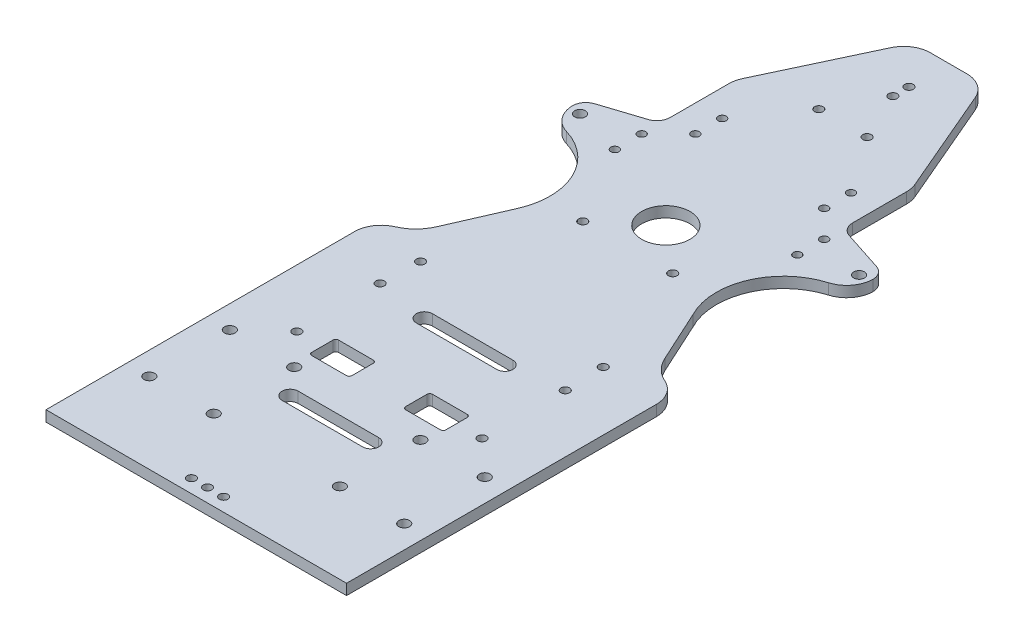
from build123d import *

# Parameters (mm, degrees)
SKETCH1_W               = 112
SKETCH1_H               = 280
SKETCH1_R               = 2
SKETCH1_R_2             = 1.5
BOSS_EXTRUDE1_DEPTH     = 2
CUT_EXTRUDE1_DEPTH      = 203.891596672
CUT_EXTRUDE1_DEPTH_BACK = 203.891596672
CUT_EXTRUDE2_DEPTH      = 203.891596672
CUT_EXTRUDE2_DEPTH_BACK = 203.891596672
SKETCH3_R               = 1.6
SKETCH4_R               = 1.6
CUT_EXTRUDE3_DEPTH      = 203.921166959
CUT_EXTRUDE4_DEPTH      = 203.891596672
CUT_EXTRUDE4_DEPTH_BACK = 203.891596672
SKETCH5_R               = 9
CUT_EXTRUDE5_DEPTH      = 203.891596672
CUT_EXTRUDE5_DEPTH_BACK = 203.891596672
SKETCH6_R               = 1.6
FILLET_1_R              = 5
SKETCH_1_R              = 25
CUT_EXTRUDE_1_DEPTH     = 10
SKETCH_2_R              = 15
SKETCH_2_R_2            = 14.533460532
CUT_EXTRUDE_2_DEPTH     = 10
CUT_EXTRUDE_START       = -5
CUT_EXTRUDE_6_DEPTH     = 6
CUT_EXTRUDE_7_DEPTH     = 6
CUT_EXTRUDE_8_DEPTH     = 5
CUT_EXTRUDE_9_DEPTH     = 5
SKETCH_9_R              = 2
CUT_EXTRUDE_11_DEPTH    = 10
SKETCH_11_R             = 2
CUT_EXTRUDE_12_DEPTH    = 5
SKETCH_12_R             = 2
EXTRUDE_1_DEPTH         = 2
SKETCH_15_R             = 2
CUT_EXTRUDE_13_DEPTH    = 250
FILLET_2_R              = 10
FILLET_3_R              = 10
FILLET_5_R              = 10
FILLET_6_R              = 10
SKETCH_17_R             = 2
CUT_EXTRUDE_16_DEPTH    = 10
CUT_EXTRUDE_17_DEPTH    = 5
CUT_EXTRUDE_18_DEPTH    = 5
FILLET_7_R              = 10
FILLET_8_R              = 10
SKETCH_20_R             = 1.6
EXTRUDE_4_DEPTH         = 7
SKETCH_22_R             = 2
EXTRUDE_6_DEPTH         = 2
SKETCH_23_R             = 1.6
CUT_EXTRUDE_19_DEPTH    = 16.5
SKETCH_24_R             = 1.6
EXTRUDE_7_DEPTH         = 16.5
SKETCH_25_R             = 2
EXTRUDE_8_DEPTH         = 2
SKETCH_26_R             = 1.6
CUT_EXTRUDE_20_DEPTH    = 16.5
SKETCH_27_R             = 1.6
CUT_EXTRUDE_21_DEPTH    = 5
SKETCH_28_R             = 1.6
CUT_EXTRUDE_22_DEPTH    = 5
SKETCH_29_R             = 1.6
CUT_EXTRUDE_23_DEPTH    = 5


with BuildPart() as part:
    # Sketch1 → Boss-Extrude1 (new, symmetric)
    with BuildSketch(Plane(origin=(0, 0, 0), x_dir=(1, 0, 0), z_dir=(0, 1, 0))):
        with Locations((0, -55)):
            Rectangle(SKETCH1_W, SKETCH1_H)
        with Locations(Location((52, 0, 0), (0, 0, 270))):
            Circle(SKETCH1_R, mode=Mode.SUBTRACT)
        with Locations(Location((34, -5, 0), (0, 0, 270))):
            Circle(SKETCH1_R_2, mode=Mode.SUBTRACT)
        with Locations(Location((34, 5, 0), (0, 0, 90))):
            Circle(SKETCH1_R_2, mode=Mode.SUBTRACT)
        with Locations(Location((24, 15, 0), (0, 0, 270))):
            Circle(SKETCH1_R_2, mode=Mode.SUBTRACT)
        with Locations(Location((24, 25, 0), (0, 0, 270))):
            Circle(SKETCH1_R_2, mode=Mode.SUBTRACT)
        with Locations(Location((47.5, -135, 0), (0, 0, 270))):
            Circle(SKETCH1_R, mode=Mode.SUBTRACT)
        with Locations(Location((23.5, -135, 0), (0, 0, 270))):
            Circle(SKETCH1_R, mode=Mode.SUBTRACT)
        with Locations(Location((23.5, -165, 0), (0, 0, 270))):
            Circle(SKETCH1_R, mode=Mode.SUBTRACT)
        with Locations(Location((47.5, -165, 0), (0, 0, 270))):
            Circle(SKETCH1_R, mode=Mode.SUBTRACT)
        with Locations(Location((-47.5, -135, 0), (0, 0, 90))):
            Circle(SKETCH1_R, mode=Mode.SUBTRACT)
        with Locations(Location((-47.5, -165, 0), (0, 0, 90))):
            Circle(SKETCH1_R, mode=Mode.SUBTRACT)
        with Locations(Location((-23.5, -165, 0), (0, 0, 90))):
            Circle(SKETCH1_R, mode=Mode.SUBTRACT)
        with Locations(Location((-23.5, -135, 0), (0, 0, 90))):
            Circle(SKETCH1_R, mode=Mode.SUBTRACT)
        with Locations(Location((-34, -5, 0), (0, 0, 90))):
            Circle(SKETCH1_R_2, mode=Mode.SUBTRACT)
        with Locations(Location((-52, 0, 0), (0, 0, 90))):
            Circle(SKETCH1_R, mode=Mode.SUBTRACT)
        with Locations(Location((-34, 5, 0), (0, 0, 270))):
            Circle(SKETCH1_R_2, mode=Mode.SUBTRACT)
        with Locations(Location((-24, 15, 0), (0, 0, 90))):
            Circle(SKETCH1_R_2, mode=Mode.SUBTRACT)
        with Locations(Location((-24, 25, 0), (0, 0, 90))):
            Circle(SKETCH1_R_2, mode=Mode.SUBTRACT)
    extrude(amount=BOSS_EXTRUDE1_DEPTH, both=True)

    # Sketch2 → Cut-Extrude1 (cut, two sides: drawn at the far end of the back side and taken through both)
    with BuildSketch(Plane(origin=(0, 0, 0), x_dir=(1, 0, 0), z_dir=(0, 1, 0)).offset(-CUT_EXTRUDE1_DEPTH_BACK)):
        Polygon((-56, 4.851766683), (-34, 12), (-34, 85), (-56, 85), align=None)
        Polygon((56, 85), (56, 4.851766683), (34, 12), (34, 85), align=None)
    extrude(amount=CUT_EXTRUDE1_DEPTH + CUT_EXTRUDE1_DEPTH_BACK, mode=Mode.SUBTRACT)

    # Sketch3 → Cut-Extrude2 (cut, two sides: drawn at the far end of the back side and taken through both)
    with BuildSketch(Plane(origin=(0, 0, 0), x_dir=(1, 0, 0), z_dir=(0, 1, 0)).offset(-CUT_EXTRUDE2_DEPTH_BACK)):
        with Locations(Location((-9, 46, 0), (0, 0, 270))):
            Circle(SKETCH3_R)
        with Locations(Location((9, 46, 0), (0, 0, 270))):
            Circle(SKETCH3_R)
    extrude(amount=CUT_EXTRUDE2_DEPTH + CUT_EXTRUDE2_DEPTH_BACK, mode=Mode.SUBTRACT)

    # Sketch4 → Cut-Extrude3 (cut, through all)
    with BuildSketch(Plane(origin=(0, 2, 0), x_dir=(1, 0, 0), z_dir=(0, 1, 0))):
        with Locations(Location((34.04, -77.38, 0), (0, 0, 270))):
            Circle(SKETCH4_R)
        with Locations(Location((-16.76, -34.2, 0), (0, 0, 270))):
            Circle(SKETCH4_R)
    cut_extrude3 = extrude(amount=-CUT_EXTRUDE3_DEPTH, mode=Mode.SUBTRACT)

    # Sketch5 → Cut-Extrude4 (cut, two sides: drawn at the far end of the back side and taken through both)
    with BuildSketch(Plane(origin=(0, 0, 0), x_dir=(1, 0, 0), z_dir=(0, 1, 0)).offset(-CUT_EXTRUDE4_DEPTH_BACK)):
        with Locations(Location((0, -20, 0), (0, 0, 270))):
            Circle(SKETCH5_R)
        with BuildLine():
            Line((-15, -92), (15, -92))
            ThreePointArc((15, -92), (18, -95), (15, -98))
            Line((15, -98), (-15, -98))
            ThreePointArc((-15, -98), (-18, -95), (-15, -92))
        make_face()
        with BuildLine():
            Line((-15, -142), (15, -142))
            ThreePointArc((15, -142), (18, -145), (15, -148))
            Line((15, -148), (-15, -148))
            ThreePointArc((-15, -148), (-18, -145), (-15, -142))
        make_face()
        with BuildLine():
            Line((11, -118), (24, -118))
            ThreePointArc((24, -118), (24.707106781, -118.292893219), (25, -119))
            Line((25, -119), (25, -127))
            ThreePointArc((25, -127), (24.707106781, -127.707106781), (24, -128))
            Line((24, -128), (11, -128))
            ThreePointArc((11, -128), (10.292893219, -127.707106781), (10, -127))
            Line((10, -127), (10, -119))
            ThreePointArc((10, -119), (10.292893219, -118.292893219), (11, -118))
        make_face()
        with BuildLine():
            Line((-25, -119), (-25, -127))
            ThreePointArc((-25, -127), (-24.707106781, -127.707106781), (-24, -128))
            Line((-24, -128), (-11, -128))
            ThreePointArc((-11, -128), (-10.292893219, -127.707106781), (-10, -127))
            Line((-10, -127), (-10, -119))
            ThreePointArc((-10, -119), (-10.292893219, -118.292893219), (-11, -118))
            Line((-11, -118), (-24, -118))
            ThreePointArc((-24, -118), (-24.707106781, -118.292893219), (-25, -119))
        make_face()
    extrude(amount=CUT_EXTRUDE4_DEPTH + CUT_EXTRUDE4_DEPTH_BACK, mode=Mode.SUBTRACT)

    # Sketch6 → Cut-Extrude5 (cut, two sides: drawn at the far end of the back side and taken through both)
    with BuildSketch(Plane(origin=(0, 0, 0), x_dir=(1, 0, 0), z_dir=(0, 1, 0)).offset(-CUT_EXTRUDE5_DEPTH_BACK)):
        with Locations(Location((-34.5, -92, 0), (0, 0, 270))):
            Circle(SKETCH6_R)
        with Locations(Location((34.5, -92, 0), (0, 0, 270))):
            Circle(SKETCH6_R)
        with Locations(Location((34.5, -123, 0), (0, 0, 270))):
            Circle(SKETCH6_R)
        with Locations(Location((-34.5, -123, 0), (0, 0, 270))):
            Circle(SKETCH6_R)
    extrude(amount=CUT_EXTRUDE5_DEPTH + CUT_EXTRUDE5_DEPTH_BACK, mode=Mode.SUBTRACT)

    # Mirror1: Cut-Extrude3 across plane
    add(cut_extrude3.mirror(Plane(origin=(0, 0, 0), x_dir=(0, 0, 1), z_dir=(1, 0, 0))), mode=Mode.SUBTRACT)

    # 圆角1
    fillet_1_edges = [part.edges().sort_by_distance(p)[0] for p in [
        (56, 0, -4.851766683),
        (34, 0, -12),
        (-56, 0, -4.851766683),
        (-34, 0, -12),
    ]]
    fillet(fillet_1_edges, radius=FILLET_1_R)

    # 草图1 → 切除-拉伸1 (cut)
    with BuildSketch(Plane(origin=(0, 2, 0), x_dir=(1, 0, 0), z_dir=(0, 1, 0))):
        with Locations((-56, -32.153325809)):
            Circle(SKETCH_1_R)
        with Locations((56, -32.153325809)):
            Circle(SKETCH_1_R)
    extrude(amount=-CUT_EXTRUDE_1_DEPTH, mode=Mode.SUBTRACT)

    # 草图2 → 切除-拉伸2 (cut)
    with BuildSketch(Plane(origin=(0, 2, 0), x_dir=(1, 0, 0), z_dir=(0, 1, 0))):
        with Locations((-56, -57.153325809)):
            Circle(SKETCH_2_R)
        with Locations((56, -57.153325809)):
            Circle(SKETCH_2_R_2)
    extrude(amount=-CUT_EXTRUDE_2_DEPTH, mode=Mode.SUBTRACT)

    # 切除-拉伸6: read off the stored shape, not the designer's step
    # 切除-拉伸6 outline → 切除-拉伸6 (cut)
    with BuildSketch(Plane(origin=(0, 2, 0), x_dir=(1, 0, 0), z_dir=(0, 1, 0)).offset(CUT_EXTRUDE_START)):
        with BuildLine():
            ThreePointArc((-41.690911979, -52.653325809), (-41.021386735, -57.954040891), (-42.252204443, -63.153168915))
            Line((-42.252204443, -63.153168915), (-33.086952257, -42.152937958))
            ThreePointArc((-33.086952257, -42.152937958), (-36.662565218, -47.998312904), (-41.690911979, -52.653325809))
        make_face()
    extrude(amount=CUT_EXTRUDE_6_DEPTH, mode=Mode.SUBTRACT)

    # 切除-拉伸7: read off the stored shape, not the designer's step
    # 切除-拉伸7 outline → 切除-拉伸7 (cut)
    with BuildSketch(Plane(origin=(0, 2, 0), x_dir=(1, 0, 0), z_dir=(0, 1, 0)).offset(CUT_EXTRUDE_START)):
        with BuildLine():
            Line((33.817769755, -43.683662376), (42.769555279, -63.16804172))
            ThreePointArc((42.769555279, -63.16804172), (41.498065161, -58.110070778), (42.094041909, -52.928896308))
            ThreePointArc((42.094041909, -52.928896308), (37.373193458, -48.827919598), (33.817769755, -43.683662376))
        make_face()
    extrude(amount=CUT_EXTRUDE_7_DEPTH, mode=Mode.SUBTRACT)

    # 草图5 → 切除-拉伸8 (cut, symmetric)
    with BuildSketch(Plane(origin=(0, 0, 0), x_dir=(1, 0, 0), z_dir=(0, 1, 0))):
        Polygon((-34, 71.940987389), (-18.114624984, 85), (-34, 85), align=None)
    extrude(amount=CUT_EXTRUDE_8_DEPTH, both=True, mode=Mode.SUBTRACT)

    # 草图6 → 切除-拉伸9 (cut, symmetric)
    with BuildSketch(Plane(origin=(0, 0, 0), x_dir=(1, 0, 0), z_dir=(0, 1, 0))):
        Polygon((34, 71.940987389), (16.763732813, 85), (34, 85), align=None)
    extrude(amount=CUT_EXTRUDE_9_DEPTH, both=True, mode=Mode.SUBTRACT)

    # 草图9 → 切除-拉伸11 (cut)
    with BuildSketch(Plane(origin=(0, 0, 0), x_dir=(1, 0, 0), z_dir=(0, 1, 0))):
        with Locations(Location((0.81, -190, 0), (0, 0, 270))):
            Circle(SKETCH_9_R)
    extrude(amount=CUT_EXTRUDE_11_DEPTH, mode=Mode.SUBTRACT)

    # 草图11 → 切除-拉伸12 (cut, symmetric)
    with BuildSketch(Plane(origin=(0, 0, 0), x_dir=(1, 0, 0), z_dir=(0, 1, 0))):
        with Locations(Location((0.81, -190, 0), (0, 0, 270))):
            Circle(SKETCH_11_R)
    extrude(amount=CUT_EXTRUDE_12_DEPTH, both=True, mode=Mode.SUBTRACT)

    # 草图12 → 凸台-拉伸1 (add, symmetric)
    with BuildSketch(Plane(origin=(0, 0, 0), x_dir=(1, 0, 0), z_dir=(0, 1, 0))):
        with Locations((0.81, -190)):
            Circle(SKETCH_12_R)
    extrude(amount=EXTRUDE_1_DEPTH, both=True)

    # 草图15 → 切除-拉伸13 (cut, symmetric)
    with BuildSketch(Plane(origin=(0, 0, 0), x_dir=(1, 0, 0), z_dir=(0, 1, 0))):
        with Locations(Location((-0.81, -190, 0), (0, 0, 270))):
            Circle(SKETCH_15_R)
    extrude(amount=CUT_EXTRUDE_13_DEPTH, both=True, mode=Mode.SUBTRACT)

    # 圆角2
    fillet_2_edges = [part.edges().sort_by_distance(p)[0] for p in [
        (-56, 0, 72.153325809),
    ]]
    fillet(fillet_2_edges, radius=FILLET_2_R)

    # 圆角3
    # the kernel refuses this fillet: 10 mm, written as the material it takes off along each edge
    with BuildSketch(Plane(origin=(-56, -22.930949629, 7.153325809), x_dir=(0.9895269126071098, 0, 0.1443484992171419), z_dir=(0, 1, 0))) as fillet_3_piece_1:
        with BuildLine():
            CenterArc((8.660909953, 9.895269126), FILLET_3_R, 189.268276471, 72.43216948)
            Line((-1.208540466, 8.284695186), (-1.405929475, 8.252483707))
            ThreePointArc((-1.405929475, 8.252483707), (-0.802175616, 4.113477893), (-0.197905383, -0.0288697))
            Line((-0.197905383, -0.0288697), (0.0288697, -0.197905383))
            ThreePointArc((0.0288697, -0.197905383), (3.60871248, 0.061827185), (7.188555261, -0.197905383))
            Line((7.188555261, -0.197905383), (7.217424961, 0))
        make_face()
    extrude(amount=45.861899257, mode=Mode.SUBTRACT)

    # 圆角5
    fillet_5_edges = [part.edges().sort_by_distance(p)[0] for p in [
        (56, 0, 71.68678634),
    ]]
    fillet(fillet_5_edges, radius=FILLET_5_R)

    # 圆角6
    # the kernel refuses this fillet: 10 mm, written as the material it takes off along each edge
    with BuildSketch(Plane(origin=(56, -22.930949629, 7.153325809), x_dir=(-0.9895269126071098, 0, 0.14434849921714205), z_dir=(0, 1, 0))) as fillet_6_piece_1:
        with BuildLine():
            CenterArc((8.660909953, -9.895269126), FILLET_6_R, 98.29955405, 72.43216948)
            Line((-1.208540466, -8.284695186), (-1.405929475, -8.252483707))
            ThreePointArc((-1.405929475, -8.252483707), (-0.802175616, -4.113477893), (-0.197905383, 0.0288697))
            Line((-0.197905383, 0.0288697), (0.0288697, 0.197905383))
            ThreePointArc((0.0288697, 0.197905383), (3.60871248, -0.061827185), (7.188555261, 0.197905383))
            Line((7.188555261, 0.197905383), (7.217424961, 0))
        make_face()
    extrude(amount=45.861899257, mode=Mode.SUBTRACT)

    # 草图17 → 切除-拉伸16 (cut, symmetric)
    with BuildSketch(Plane(origin=(0, 0, 0), x_dir=(1, 0, 0), z_dir=(0, 1, 0))):
        with Locations(Location((0.595375016, 70, 0), (0, 0, 270))):
            Circle(SKETCH_17_R)
    extrude(amount=CUT_EXTRUDE_16_DEPTH, both=True, mode=Mode.SUBTRACT)

    # 草图18 → 切除-拉伸17 (cut, symmetric)
    with BuildSketch(Plane(origin=(0, 0, 0), x_dir=(1, 0, 0), z_dir=(0, 1, 0))):
        Polygon((-11.392075785, 87.867298623), (-36.815883507, 33.710075075), (-63.292748353, 82.602013001), align=None)
    extrude(amount=CUT_EXTRUDE_17_DEPTH, both=True, mode=Mode.SUBTRACT)

    # 草图19 → 切除-拉伸18 (cut, symmetric)
    with BuildSketch(Plane(origin=(0, 0, 0), x_dir=(1, 0, 0), z_dir=(0, 1, 0))):
        Polygon((13.791270616, 85), (34, 37.765011841), (51.054063119, 37.765011841), (57.938009556, 70.02787223), (19.299009454, 103.397917773), align=None)
    extrude(amount=CUT_EXTRUDE_18_DEPTH, both=True, mode=Mode.SUBTRACT)

    # 圆角7
    fillet_7_edges = [part.edges().sort_by_distance(p)[0] for p in [
        (13.791270616, 0, -85),
    ]]
    fillet(fillet_7_edges, radius=FILLET_7_R)

    # 圆角8
    fillet_8_edges = [part.edges().sort_by_distance(p)[0] for p in [
        (-34, 0, -39.708406805),
        (-12.738113195, 0, -85),
        (34, 0, -37.765011841),
    ]]
    fillet(fillet_8_edges, radius=FILLET_8_R)



with BuildPart() as body_2:
    # 草图20 → 凸台-拉伸4 (new, symmetric)
    with BuildSketch(Plane(origin=(0, 0, 0), x_dir=(1, 0, 0), z_dir=(0, 1, 0))):
        with Locations(Location((0.595375016, 70, 0), (0, 0, 270))):
            Circle(SKETCH_20_R)
    extrude(amount=EXTRUDE_4_DEPTH, both=True)


with BuildPart() as part_1:
    add(part.part)

    add(body_2.part)  # 凸台-拉伸6 merges body 2
    # 草图22 → 凸台-拉伸6 (add, symmetric)
    with BuildSketch(Plane(origin=(0, 0, 0), x_dir=(1, 0, 0), z_dir=(0, 1, 0))):
        with Locations((0.595375016, 70)):
            Circle(SKETCH_22_R)
    extrude(amount=EXTRUDE_6_DEPTH, both=True)

    # 草图23 → 切除-拉伸19 (cut, symmetric)
    with BuildSketch(Plane(origin=(0, 0, 0), x_dir=(1, 0, 0), z_dir=(0, 1, 0))):
        with Locations(Location((0.595375016, 70, 0), (0, 0, 270))):
            Circle(SKETCH_23_R)
    extrude(amount=CUT_EXTRUDE_19_DEPTH, both=True, mode=Mode.SUBTRACT)



with BuildPart() as body_2_2:
    # 草图24 → 凸台-拉伸7 (new, symmetric)
    with BuildSketch(Plane(origin=(0, 0, 0), x_dir=(1, 0, 0), z_dir=(0, 1, 0))):
        with Locations(Location((-0.81, -190, 0), (0, 0, 270))):
            Circle(SKETCH_24_R)
    extrude(amount=EXTRUDE_7_DEPTH, both=True)


with BuildPart() as part_2:
    add(part_1.part)

    add(body_2_2.part)  # 凸台-拉伸8 merges body 2 2
    # 草图25 → 凸台-拉伸8 (add, symmetric)
    with BuildSketch(Plane(origin=(0, 0, 0), x_dir=(1, 0, 0), z_dir=(0, 1, 0))):
        with Locations((-0.81, -190)):
            Circle(SKETCH_25_R)
    extrude(amount=EXTRUDE_8_DEPTH, both=True)

    # 草图26 → 切除-拉伸20 (cut, symmetric)
    with BuildSketch(Plane(origin=(0, 0, 0), x_dir=(1, 0, 0), z_dir=(0, 1, 0))):
        with Locations(Location((-0.81, -190, 0), (0, 0, 270))):
            Circle(SKETCH_26_R)
    extrude(amount=CUT_EXTRUDE_20_DEPTH, both=True, mode=Mode.SUBTRACT)

    # 草图27 → 切除-拉伸21 (cut, symmetric)
    with BuildSketch(Plane(origin=(0, 0, 0), x_dir=(1, 0, 0), z_dir=(0, 1, 0))):
        with Locations(Location((5.19, -190, 0), (0, 0, 270))):
            Circle(SKETCH_27_R)
    extrude(amount=CUT_EXTRUDE_21_DEPTH, both=True, mode=Mode.SUBTRACT)

    # 草图28 → 切除-拉伸22 (cut, symmetric)
    with BuildSketch(Plane(origin=(0, 0, 0), x_dir=(1, 0, 0), z_dir=(0, 1, 0))):
        with Locations(Location((-6.81, -190, 0), (0, 0, 270))):
            Circle(SKETCH_28_R)
    extrude(amount=CUT_EXTRUDE_22_DEPTH, both=True, mode=Mode.SUBTRACT)

    # 草图29 → 切除-拉伸23 (cut, symmetric)
    with BuildSketch(Plane(origin=(0, 0, 0), x_dir=(1, 0, 0), z_dir=(0, 1, 0))):
        with Locations(Location((0.595375016, 64, 0), (0, 0, 270))):
            Circle(SKETCH_29_R)
    extrude(amount=CUT_EXTRUDE_23_DEPTH, both=True, mode=Mode.SUBTRACT)


solid = part_2.part
